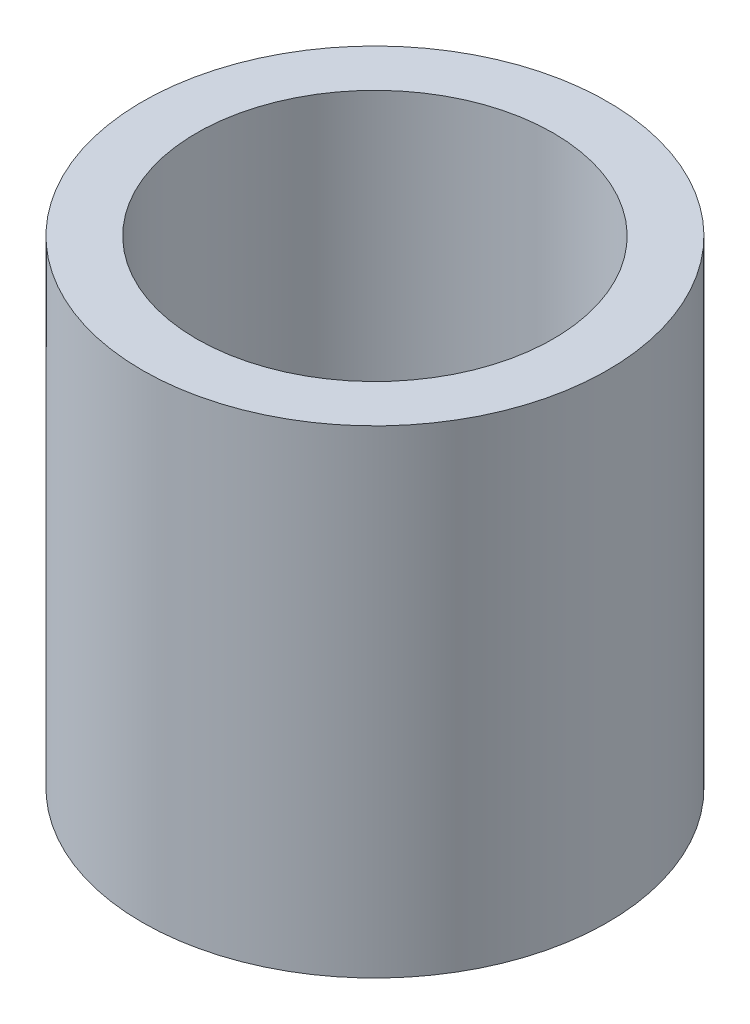
from build123d import *

# Parameters (mm, degrees)
SKETCH1_R           = 9
SKETCH1_R_2         = 6.9
BOSS_EXTRUDE1_DEPTH = 18.5


with BuildPart() as part:
    # Sketch1 → Boss-Extrude1 (new body)
    with BuildSketch(Plane(origin=(0, 0, 0), x_dir=(1, 0, 0), z_dir=(0, 1, 0))):
        Circle(SKETCH1_R)
        Circle(SKETCH1_R_2, mode=Mode.SUBTRACT)
    extrude(amount=BOSS_EXTRUDE1_DEPTH)


solid = part.part
